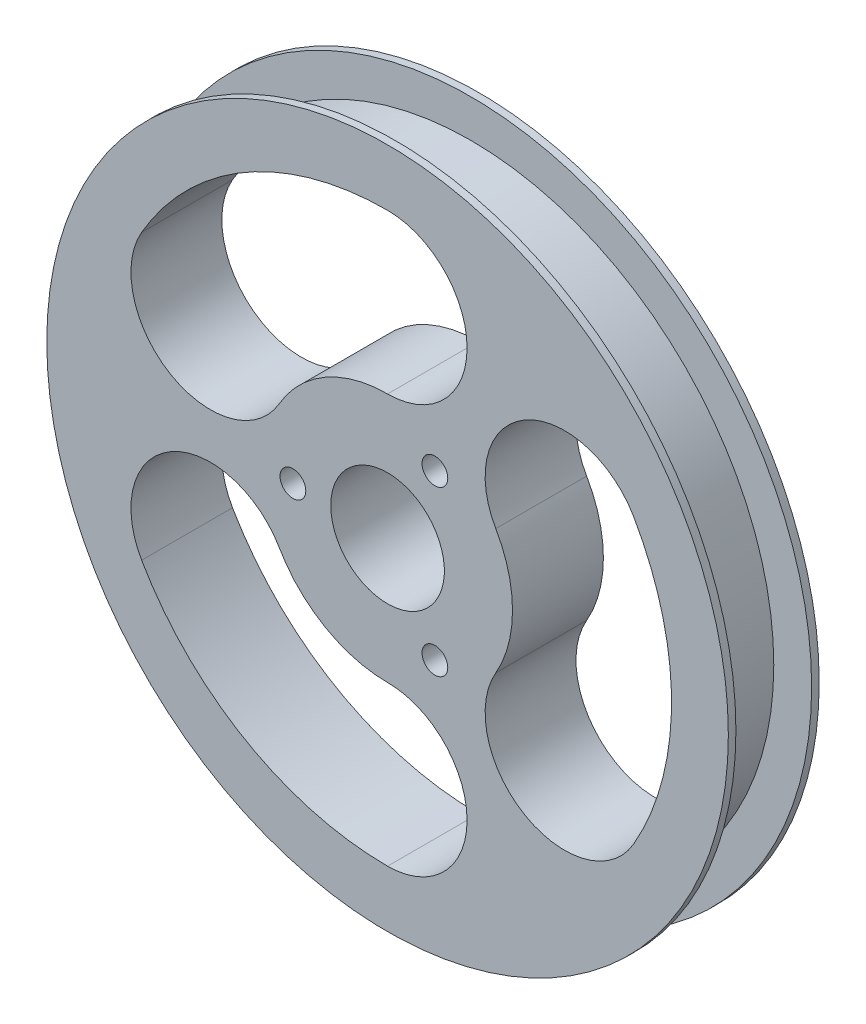
from build123d import *

# Parameters (mm, degrees)
SKETCH_1_R          = 40
EXTRUDE_1_DEPTH     = 10
SKETCH_8_R          = 45
EXTRUDE_3_DEPTH     = 1
EXTRUDE_START       = 1
SKETCH_21_R         = 45
EXTRUDE_4_DEPTH     = 1
SKETCH_2_R          = 7.5
CUT_EXTRUDE_1_DEPTH = 65.761099435
HOLE_WIZARD_M32_D   = 3.4
CUT_EXTRUDE_2_DEPTH = 65.761099435


with BuildPart() as part:
    # Эскиз1 → Бобышка-Вытянуть1 (new body)
    with BuildSketch(Plane.XY):
        Circle(SKETCH_1_R)
    extrude(amount=EXTRUDE_1_DEPTH)

    # Эскиз8 → Бобышка-Вытянуть3 (add)
    with BuildSketch(Plane.XY.offset(10)):
        Circle(SKETCH_8_R)
    extrude(amount=EXTRUDE_3_DEPTH)

    # Эскиз21 → Бобышка-Вытянуть4 (add)
    with BuildSketch(Plane(origin=(0, 0, 0), x_dir=(-1, 0, 0), z_dir=(0, 0, -1)).offset(EXTRUDE_START)):
        Circle(SKETCH_21_R)
    extrude(amount=-EXTRUDE_4_DEPTH)

    # Эскиз2 → Вырез-Вытянуть1 (cut, through all)
    with BuildSketch(Plane(origin=(0, 0, 11), x_dir=(-1, 0, 0), z_dir=(0, 0, -1))):
        Circle(SKETCH_2_R)
    extrude(amount=CUT_EXTRUDE_1_DEPTH, mode=Mode.SUBTRACT)

    # Отверстие с зазором M32 (through all)
    with Locations(Plane.XY.offset(11)):
        with Locations((6.25, 10.825317547), (-12.5, 0), (6.25, -10.825317547)):
            Hole(HOLE_WIZARD_M32_D / 2)

    # Эскиз10 → Вырез-Вытянуть2 (cut, through all)
    with BuildSketch(Plane(origin=(0, 0, 11), x_dir=(-1, 0, 0), z_dir=(0, 0, -1))):
        with BuildLine():
            ThreePointArc((32.475952642, -18.75), (28.632685902, -4.40673326), (14.289419162, -8.25))
            ThreePointArc((14.289419162, -8.25), (8.25, -14.289419162), (0, -16.5))
            ThreePointArc((0, -16.5), (-10.5, -27), (0, -37.5))
            ThreePointArc((0, -37.5), (18.75, -32.475952642), (32.475952642, -18.75))
        make_face()
        with BuildLine():
            ThreePointArc((32.475952642, 18.75), (18.75, 32.475952642), (0, 37.5))
            ThreePointArc((0, 37.5), (-10.5, 27), (0, 16.5))
            ThreePointArc((0, 16.5), (8.25, 14.289419162), (14.289419162, 8.25))
            ThreePointArc((14.289419162, 8.25), (28.632685902, 4.40673326), (32.475952642, 18.75))
        make_face()
        with BuildLine():
            ThreePointArc((-32.475952642, -18.75), (-18.132685902, -22.59326674), (-14.289419162, -8.25))
            ThreePointArc((-14.289419162, -8.25), (-16.5, 0), (-14.289419162, 8.25))
            ThreePointArc((-14.289419162, 8.25), (-18.132685902, 22.59326674), (-32.475952642, 18.75))
            ThreePointArc((-32.475952642, 18.75), (-37.5, 0), (-32.475952642, -18.75))
        make_face()
    extrude(amount=CUT_EXTRUDE_2_DEPTH, mode=Mode.SUBTRACT)


solid = part.part
